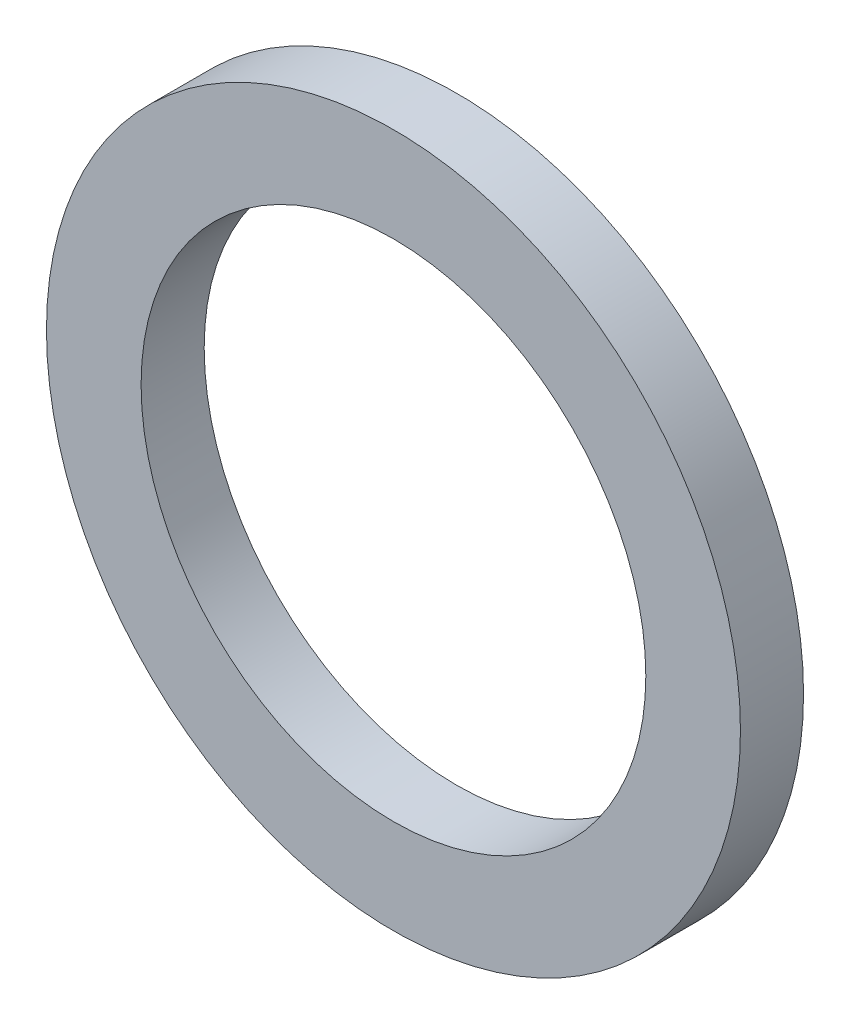
from build123d import *

# Parameters (mm, degrees)
SKETCH1_R      = 27.5
SKETCH1_R_2    = 20
EXTRUDE1_DEPTH = 5


with BuildPart() as part:
    # Sketch1 → Extrude1 (new body)
    with BuildSketch(Plane.XY):
        Circle(SKETCH1_R)
        Circle(SKETCH1_R_2, mode=Mode.SUBTRACT)
    extrude(amount=EXTRUDE1_DEPTH)


solid = part.part
